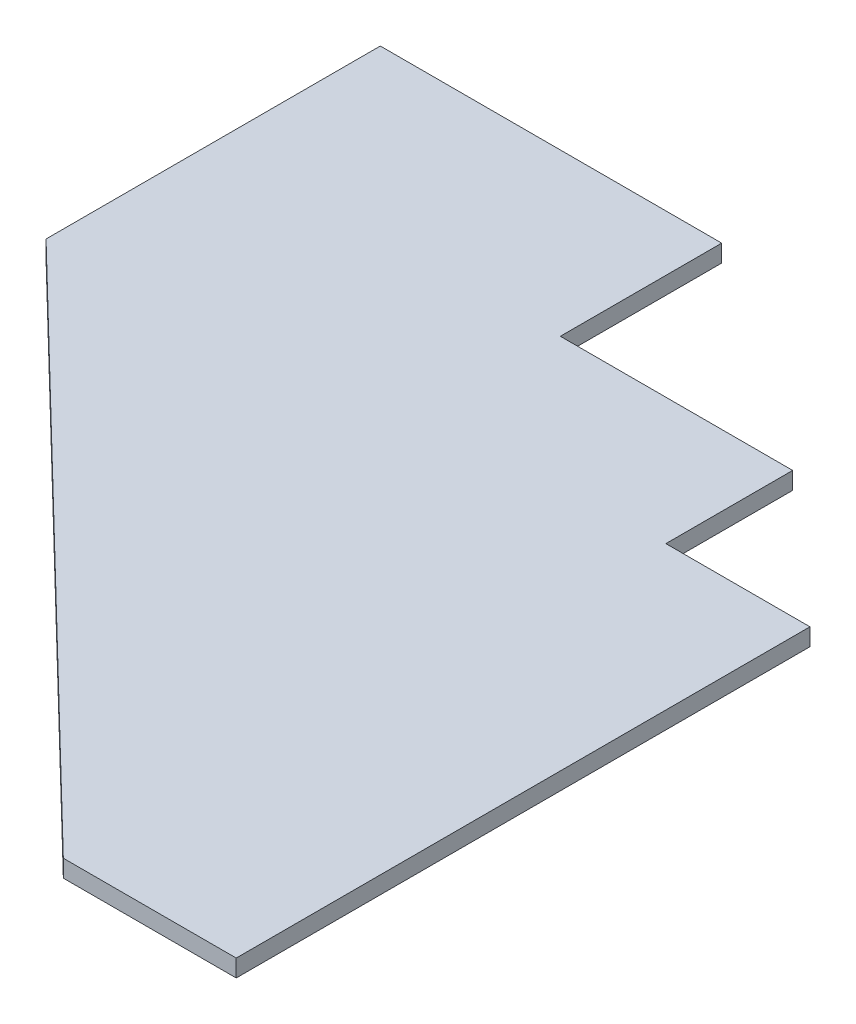
from build123d import *

# Parameters (mm, degrees)
SM_BASE_FLANGE_1_DEPTH = 6


# Sheet-metal steps are written as plain solids
with BuildPart() as part:
    # Sketch 1 → Базовая кромка1 (new body)
    with BuildSketch(Plane(origin=(0, 0, 0), x_dir=(1, 0, 0), z_dir=(0, 1, 0))):
        Polygon((0, 44), (0, 0), (50, 0), (50, -199.111234032), (-10, -199.111234032), (-199.111234032, -16), (-199.111234032, 44), (-199.111234032, 100), (-80.626438318, 100), (-80.626438318, 44), align=None)
    extrude(amount=-SM_BASE_FLANGE_1_DEPTH)


solid = part.part
